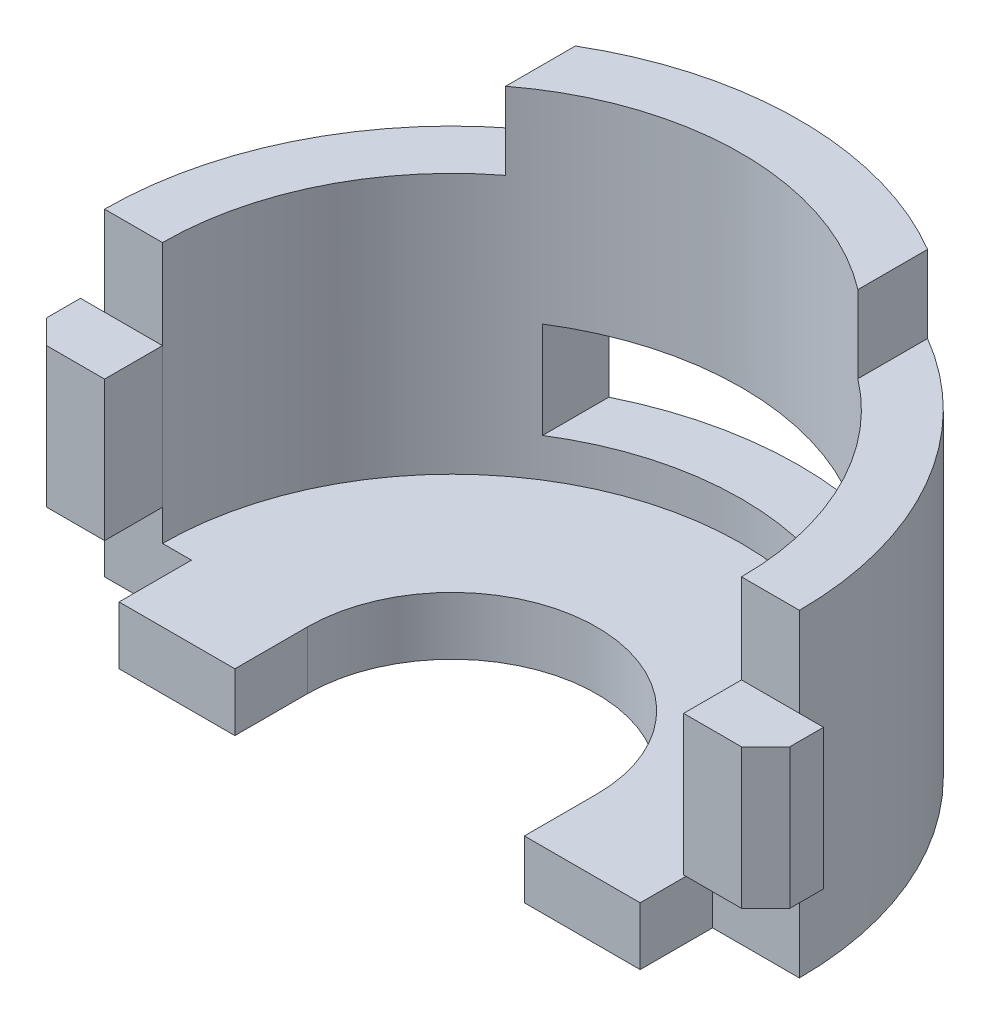
from build123d import *

# Parameters (mm, degrees)
SKETCH1_W                = 6
SKETCH1_H                = 1.2
SKETCH1_W_2              = 1.2
SKETCH1_H_2              = 5.4
REVOLVE1_ANGLE           = 180
REVOLVE2_START           = 5.4
REVOLVE2_DEPTH           = 1.6
SKETCH4_W                = 6.4
SKETCH4_H                = 2
CUT_EXTRUDE1_DEPTH       = 10
SKETCH5_R                = 3
CUT_EXTRUDE2_DEPTH       = 10
SKETCH6_W                = 2.4
SKETCH6_H                = 1.5
BOSS_EXTRUDE1_DEPTH      = 1.2
SKETCH7_W                = 1.2
SKETCH7_H                = 2.9
BOSS_EXTRUDE2_DEPTH      = 1.7
CHAMFER1_SIZE            = 0.5
CHAMFER1_OF_MIRROR1_SIZE = 0.5


# Read off the part's stored shape, not the designer's step: Revolve2
with BuildPart() as part:
    # Sketch1 → Revolve1 (revolve)
    with BuildSketch(Plane.XY):
        with Locations((3, -0.6)):
            Rectangle(SKETCH1_W, SKETCH1_H)
        with Locations((6.6, -0.6)):
            Rectangle(SKETCH1_W_2, SKETCH1_H)
        with Locations((6.6, 2.7)):
            Rectangle(SKETCH1_W_2, SKETCH1_H_2)
    revolve(axis=Axis((0, -1.2, 0), (0, 1, 0)), revolution_arc=REVOLVE1_ANGLE)

    # Revolve2 outline → Revolve2 (add)
    with BuildSketch(Plane(origin=(0, 0, 0), x_dir=(1, 0, 0), z_dir=(0, 1, 0)).offset(REVOLVE2_START)):
        with BuildLine():
            ThreePointArc((3.65, 6.206246853), (0, 7.2), (-3.65, 6.206246853))
            Line((-3.65, 6.206246853), (-3.65, 4.762089877))
            ThreePointArc((-3.65, 4.762089877), (0, 6), (3.65, 4.762089877))
            Line((3.65, 4.762089877), (3.65, 6.206246853))
        make_face()
    extrude(amount=REVOLVE2_DEPTH)

    # Sketch4 → Cut-Extrude1 (cut)
    with BuildSketch(Plane.XY):
        with Locations((0, 1.8)):
            Rectangle(SKETCH4_W, SKETCH4_H)
    extrude(amount=-CUT_EXTRUDE1_DEPTH, mode=Mode.SUBTRACT)

    # Sketch5 → Cut-Extrude2 (cut)
    with BuildSketch(Plane(origin=(0, 0, 0), x_dir=(1, 0, 0), z_dir=(0, 1, 0))):
        Circle(SKETCH5_R)
    extrude(amount=-CUT_EXTRUDE2_DEPTH, mode=Mode.SUBTRACT)

    # Sketch6 → Boss-Extrude1 (add)
    with BuildSketch(Plane(origin=(0, 0, 0), x_dir=(1, 0, 0), z_dir=(0, 1, 0))):
        with Locations((-4.2, -0.75)):
            Rectangle(SKETCH6_W, SKETCH6_H)
    boss_extrude1 = extrude(amount=-BOSS_EXTRUDE1_DEPTH)

    # Sketch7 → Boss-Extrude2 (add)
    with BuildSketch(Plane(origin=(-6, 0, 0), x_dir=(0, 0, -1), z_dir=(1, 0, 0))):
        with Locations((-0.6, 2.1)):
            Rectangle(SKETCH7_W, SKETCH7_H)
    boss_extrude2 = extrude(amount=-BOSS_EXTRUDE2_DEPTH)

    # Chamfer1
    chamfer1_edges = [part.edges().sort_by_distance(p)[0] for p in [
        (-7.7, 2.1, 1.2),
    ]]
    chamfer(chamfer1_edges, length=CHAMFER1_SIZE)

    # Mirror1: Boss-Extrude1, Boss-Extrude2 across plane
    add(boss_extrude1.mirror(Plane(origin=(0, 0, 0), x_dir=(0, 0, 1), z_dir=(1, 0, 0))))
    add(boss_extrude2.mirror(Plane(origin=(0, 0, 0), x_dir=(0, 0, 1), z_dir=(1, 0, 0))))

    # Chamfer1 of Mirror1
    chamfer1_of_mirror1_edges = [part.edges().sort_by_distance(p)[0] for p in [
        (7.7, 2.1, 1.2),
    ]]
    chamfer(chamfer1_of_mirror1_edges, length=CHAMFER1_OF_MIRROR1_SIZE)


solid = part.part
